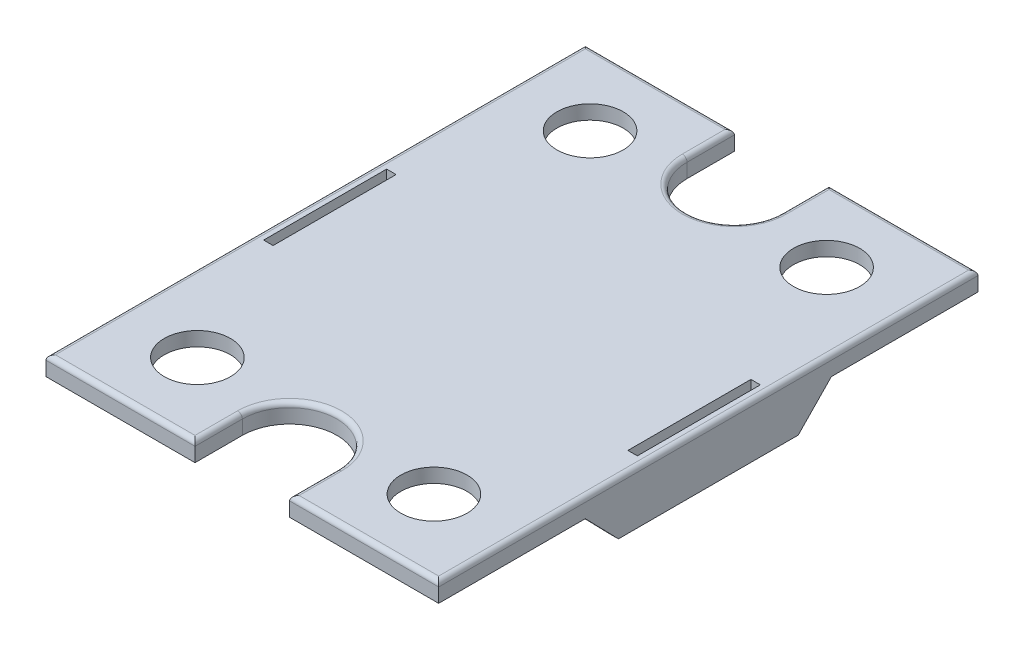
from build123d import *

# Parameters (mm, degrees)
SKETCH1_W           = 41.5
SKETCH1_H           = 57
BOSS_EXTRUDE1_DEPTH = 2
CUT_EXTRUDE1_DEPTH  = 36.310232228
SKETCH3_R           = 3.5
CUT_EXTRUDE2_DEPTH  = 36.310232228
SKETCH4_W           = 2
SKETCH4_H           = 13
CUT_EXTRUDE3_DEPTH  = 36.310232228
CUT_EXTRUDE4_DEPTH  = 0.5
BOSS_EXTRUDE2_DEPTH = 1
SKETCH7_W           = 3.5
SKETCH7_H           = 0.6
BOSS_EXTRUDE3_DEPTH = 0.3
FILLET1_R           = 0.5


with BuildPart() as part:
    # Sketch1 → Boss-Extrude1 (new body)
    with BuildSketch(Plane(origin=(0, 0, 0), x_dir=(1, 0, 0), z_dir=(0, 1, 0))):
        Rectangle(SKETCH1_W, SKETCH1_H)
    extrude(amount=BOSS_EXTRUDE1_DEPTH)

    # Sketch2 → Cut-Extrude1 (cut, through all)
    with BuildSketch(Plane(origin=(0, 2, 0), x_dir=(1, 0, 0), z_dir=(0, 1, 0))):
        with BuildLine():
            Line((-5, -23.5), (-5, -28.5))
            Line((-5, -28.5), (5, -28.5))
            Line((5, -28.5), (5, -23.5))
            ThreePointArc((5, -23.5), (0, -18.5), (-5, -23.5))
        make_face()
    cut_extrude1 = extrude(amount=-CUT_EXTRUDE1_DEPTH, mode=Mode.SUBTRACT)

    # Sketch3 → Cut-Extrude2 (cut, through all)
    with BuildSketch(Plane(origin=(0, 2, 0), x_dir=(1, 0, 0), z_dir=(0, 1, 0))):
        with Locations((-12.5, -20.75)):
            Circle(SKETCH3_R)
        with Locations((12.5, -20.75)):
            Circle(SKETCH3_R)
    cut_extrude2 = extrude(amount=-CUT_EXTRUDE2_DEPTH, mode=Mode.SUBTRACT)

    # Mirror1: Cut-Extrude1, Cut-Extrude2 across plane
    add(cut_extrude1.mirror(Plane.XY), mode=Mode.SUBTRACT)
    add(cut_extrude2.mirror(Plane.XY), mode=Mode.SUBTRACT)

    # Sketch4 → Cut-Extrude3 (cut, through all)
    with BuildSketch(Plane(origin=(0, 2, 0), x_dir=(1, 0, 0), z_dir=(0, 1, 0))):
        with Locations((-19.75, 0)):
            Rectangle(SKETCH4_W, SKETCH4_H)
        with Locations((19.75, 0)):
            Rectangle(SKETCH4_W, SKETCH4_H)
    extrude(amount=-CUT_EXTRUDE3_DEPTH, mode=Mode.SUBTRACT)

    # Sketch5 → Cut-Extrude4 (cut)
    with BuildSketch(Plane(origin=(0, 0, 0), x_dir=(1, 0, 0), z_dir=(0, 1, 0))):
        with BuildLine():
            Line((-18.75, 26.5), (-18.75, 8.5))
            Line((-18.75, 8.5), (-16.75, 8.5))
            Line((-16.75, 8.5), (-16.75, -8.5))
            Line((-16.75, -8.5), (-18.75, -8.5))
            Line((-18.75, -8.5), (-18.75, -26.5))
            Line((-18.75, -26.5), (-7, -26.5))
            Line((-7, -26.5), (-7, -23.5))
            ThreePointArc((-7, -23.5), (0, -16.5), (7, -23.5))
            Line((7, -23.5), (7, -26.5))
            Line((7, -26.5), (18.75, -26.5))
            Line((18.75, -26.5), (18.75, -8.5))
            Line((18.75, -8.5), (16.75, -8.5))
            Line((16.75, -8.5), (16.75, 8.5))
            Line((16.75, 8.5), (18.75, 8.5))
            Line((18.75, 8.5), (18.75, 26.5))
            Line((18.75, 26.5), (7, 26.5))
            Line((7, 26.5), (7, 23.5))
            ThreePointArc((7, 23.5), (0, 16.5), (-7, 23.5))
            Line((-7, 23.5), (-7, 26.5))
            Line((-7, 26.5), (-18.75, 26.5))
        make_face()
    extrude(amount=CUT_EXTRUDE4_DEPTH, mode=Mode.SUBTRACT)

    # Sketch6 → Boss-Extrude2 (add)
    with BuildSketch(Plane.ZY.offset(20.75)):
        Polygon((-13, 2), (13, 2), (13, 0), (9.5, -3.6), (-9.5, -3.6), (-13, 0), align=None)
    boss_extrude2 = extrude(amount=-BOSS_EXTRUDE2_DEPTH)

    # Sketch7 → Boss-Extrude3 (add)
    with BuildSketch(Plane(origin=(-19.75, 0, 0), x_dir=(0, 0, -1), z_dir=(1, 0, 0))):
        with Locations((-4.75, -3.3)):
            Rectangle(SKETCH7_W, SKETCH7_H)
        with Locations((4.75, -3.3)):
            Rectangle(SKETCH7_W, SKETCH7_H)
    boss_extrude3 = extrude(amount=BOSS_EXTRUDE3_DEPTH)

    # Mirror2: Boss-Extrude2, Boss-Extrude3 across plane
    add(boss_extrude2.mirror(Plane(origin=(0, 0, 0), x_dir=(0, 0, 1), z_dir=(1, 0, 0))))
    add(boss_extrude3.mirror(Plane(origin=(0, 0, 0), x_dir=(0, 0, 1), z_dir=(1, 0, 0))))

    # Fillet1
    fillet1_edges = [part.edges().sort_by_distance(p)[0] for p in [
        (-5, 2, 26),
        (0, 2, 18.5),
        (5, 2, -26),
        (0, 2, -18.5),
        (5, 2, 26),
        (12.875, 2, 28.5),
        (20.75, 2, 0),
        (12.875, 2, -28.5),
        (-5, 2, -26),
        (-12.875, 2, -28.5),
        (-20.75, 2, 0),
        (-12.875, 2, 28.5),
    ]]
    fillet(fillet1_edges, radius=FILLET1_R)


solid = part.part
